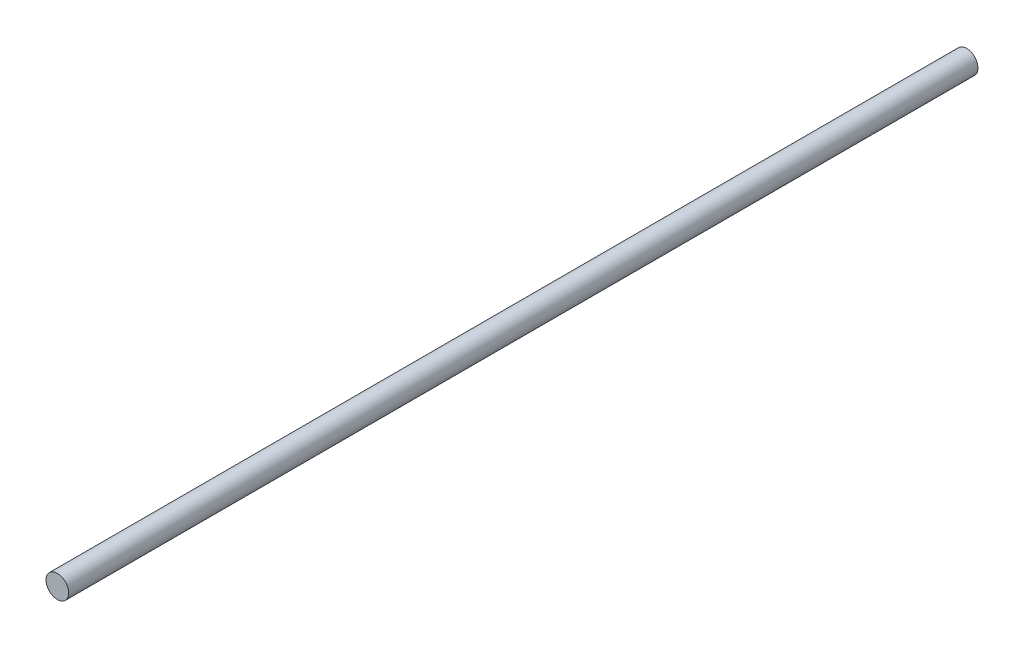
from build123d import *

# Parameters (mm, degrees)
SKETCH1_R           = 5
BOSS_EXTRUDE1_DEPTH = 200


with BuildPart() as part:
    # Sketch1 → Boss-Extrude1 (new, symmetric)
    with BuildSketch(Plane.XY):
        Circle(SKETCH1_R)
    extrude(amount=BOSS_EXTRUDE1_DEPTH, both=True)


solid = part.part
